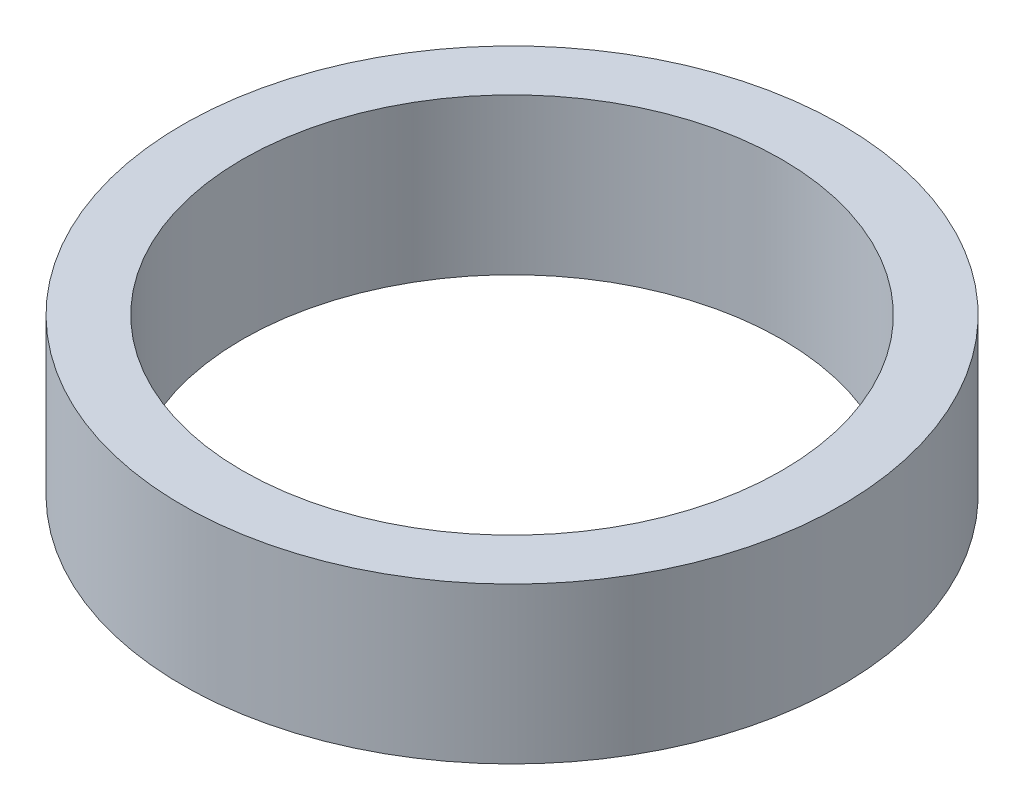
from build123d import *

# Parameters (mm, degrees)
SKETCH1_R           = 55
BOSS_EXTRUDE1_DEPTH = 26
SKETCH2_R           = 45
CUT_EXTRUDE1_DEPTH  = 83.012194215


with BuildPart() as part:
    # Sketch1 → Boss-Extrude1 (new body)
    with BuildSketch(Plane(origin=(0, 0, 0), x_dir=(1, 0, 0), z_dir=(0, 1, 0))):
        Circle(SKETCH1_R)
    extrude(amount=BOSS_EXTRUDE1_DEPTH)

    # Sketch2 → Cut-Extrude1 (cut, through all)
    with BuildSketch(Plane(origin=(0, 0, 0), x_dir=(1, 0, 0), z_dir=(0, 1, 0))):
        Circle(SKETCH2_R)
    extrude(amount=CUT_EXTRUDE1_DEPTH, mode=Mode.SUBTRACT)


solid = part.part
